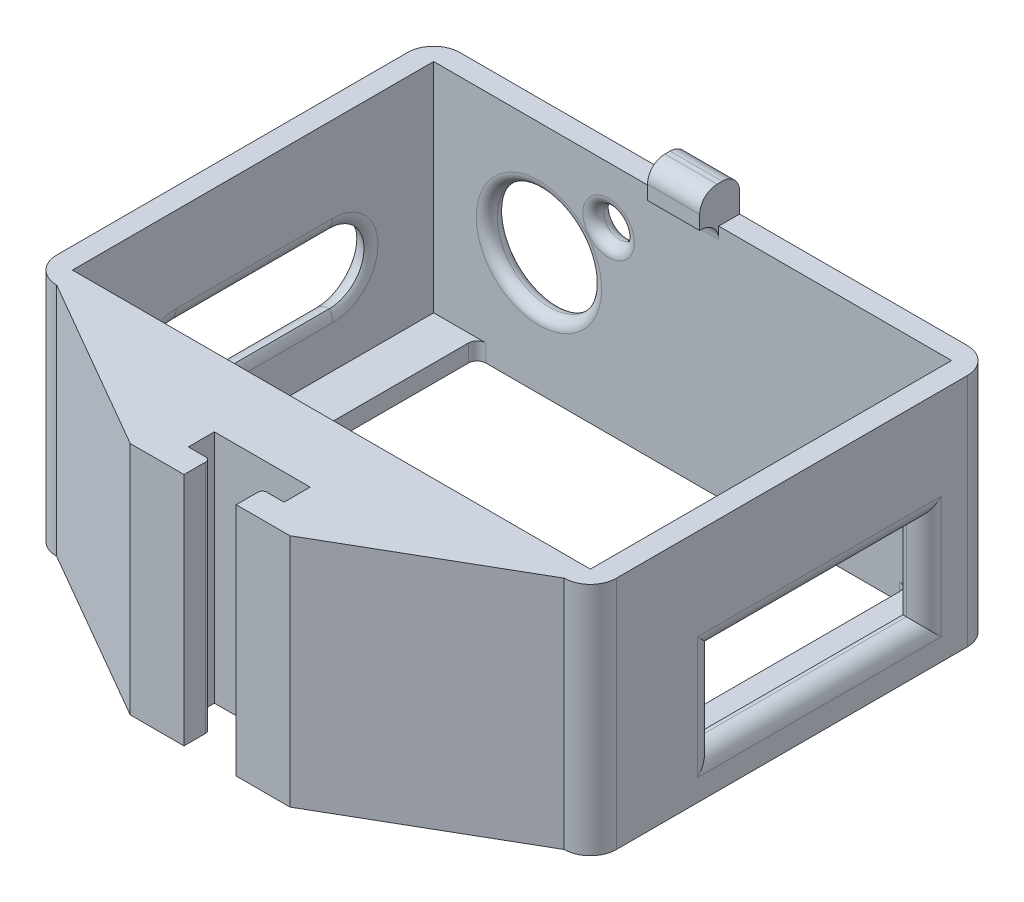
from build123d import *

# Parameters (mm, degrees)
SKETCH_1_W          = 64.3
SKETCH_1_H          = 46.3
SKETCH_1_W_2        = 59.5
SKETCH_1_H_2        = 41.5
EXTRUDE_2_DEPTH     = 27
SKETCH_1_3_W        = 5
SKETCH_1_3_H        = 41.5
EXTRUDE_3_DEPTH     = 2
FILLET_1_R          = 3
FILLET_2_R          = 1
SKETCH_2_R          = 6
SKETCH_2_R_2        = 1.75
CUT_EXTRUDE_2_DEPTH = 8
SKETCH_4_W          = 24
SKETCH_4_H          = 10
CUT_EXTRUDE_4_DEPTH = 12
FILLET_5_R          = 2
CUT_EXTRUDE_5_DEPTH = 12
FILLET_6_R          = 2
FILLET_7_R          = 2
FILLET_16_R         = 1.2
EXTRUDE_9_DEPTH     = 3
EXTRUDE_11_DEPTH    = 27
CUT_EXTRUDE_6_DEPTH = 81.54700491
FILLET_17_R         = 0.5


# Some blends are built 0.0001 mm under size
with BuildPart() as part:
    # Эскиз1 → Бобышка-Вытянуть2 (new body)
    with BuildSketch(Plane(origin=(0, 0, 0), x_dir=(1, 0, 0), z_dir=(0, 1, 0))):
        with Locations((29.75, 20.75)):
            Rectangle(SKETCH_1_W, SKETCH_1_H)
        with Locations((29.75, 20.75)):
            Rectangle(SKETCH_1_W_2, SKETCH_1_H_2, mode=Mode.SUBTRACT)
    extrude(amount=EXTRUDE_2_DEPTH)

    # Эскиз1<3> → Бобышка-Вытянуть3 (add)
    with BuildSketch(Plane(origin=(0, 0, 0), x_dir=(1, 0, 0), z_dir=(0, 1, 0))):
        with Locations((2.5, 20.75)):
            Rectangle(SKETCH_1_3_W, SKETCH_1_3_H)
        with Locations((57, 20.75)):
            Rectangle(SKETCH_1_3_W, SKETCH_1_3_H)
    extrude(amount=EXTRUDE_3_DEPTH)

    # Скругление1
    fillet_1_edges = [part.edges().sort_by_distance(p)[0] for p in [
        (-2.4, 13.5, -43.9),
        (61.9, 13.5, -43.9),
        (61.9, 13.5, 2.4),
        (-2.4, 13.5, 2.4),
    ]]
    fillet(fillet_1_edges, radius=FILLET_1_R)

    # Скругление2
    fillet_2_edges = [part.edges().sort_by_distance(p)[0] for p in [
        (5, 1, 0),
        (5, 1, -41.5),
        (54.5, 1, -41.5),
        (54.5, 1, 0),
    ]]
    fillet(fillet_2_edges, radius=FILLET_2_R)

    # Эскиз2 → Вырез-Вытянуть2 (cut)
    with BuildSketch(Plane(origin=(0, 0, -43.9), x_dir=(-1, 0, 0), z_dir=(0, 0, -1))):
        with Locations((-12.1, 14)):
            Circle(SKETCH_2_R)
        with Locations((-20.1, 20.5)):
            Circle(SKETCH_2_R_2)
    extrude(amount=-CUT_EXTRUDE_2_DEPTH, mode=Mode.SUBTRACT)

    # Эскиз4 → Вырез-Вытянуть4 (cut)
    with BuildSketch(Plane(origin=(61.9, 0, 0), x_dir=(0, 0, -1), z_dir=(1, 0, 0))):
        with Locations((23.9, 9.5)):
            Rectangle(SKETCH_4_W, SKETCH_4_H)
    extrude(amount=-CUT_EXTRUDE_4_DEPTH, mode=Mode.SUBTRACT)

    # Скругление5
    fillet_5_edges = [part.edges().sort_by_distance(p)[0] for p in [
        (61.9, 14.5, -23.9),
        (61.9, 9.5, -35.9),
        (61.9, 9.5, -11.9),
        (61.9, 4.5, -23.9),
    ]]
    fillet(fillet_5_edges, radius=FILLET_5_R)

    # Эскиз10 → Вырез-Вытянуть5 (cut)
    with BuildSketch(Plane.ZY.offset(2.4)):
        with BuildLine():
            Line((-29.9, 16), (-11.9, 16))
            ThreePointArc((-11.9, 16), (-7.9, 12), (-11.9, 8))
            Line((-11.9, 8), (-29.9, 8))
            ThreePointArc((-29.9, 8), (-33.9, 12), (-29.9, 16))
        make_face()
    extrude(amount=-CUT_EXTRUDE_5_DEPTH, mode=Mode.SUBTRACT)

    # Скругление6
    fillet_6_edges = [part.edges().sort_by_distance(p)[0] for p in [
        (-2.4, 16, -20.9),
        (-2.4, 12, -33.9),
        (-2.4, 8, -20.9),
        (-2.4, 12, -7.9),
    ]]
    fillet(fillet_6_edges, radius=FILLET_6_R)

    # Скругление7
    # the kernel refuses this fillet: 2 mm, written as the material it takes off along each edge
    with BuildSketch(Plane(origin=(0, 8, -29.9), x_dir=(-1, 0, 0), z_dir=(0, 0, 1)), Plane(origin=(0, 16, -11.9), x_dir=(-1, 0, 0), z_dir=(0, 0, -1))) as fillet_7_piece_1:
        with BuildLine():
            CenterArc((2, 1.2), FILLET_7_R, 180, 36.869897646)
            Line((0, 1.2), (-0.04, 1.2))
            Line((-0.04, 1.2), (-0.04, 0))
            Line((-0.04, 0), (0, -0.04))
            ThreePointArc((0, -0.04), (0.2, -0.04), (0.368, -0.024))
            Line((0.368, -0.024), (0.4, 0))
        make_face()
    extrude(amount=18, mode=Mode.SUBTRACT)
    with BuildSketch(Plane(origin=(0, 12, -29.9), x_dir=(0, 1, 0), z_dir=(0, 0, 1))) as fillet_7_piece_2:
        with BuildLine():
            CenterArc((5.2, 2), FILLET_7_R, 233.130102354, 36.869897646)
            Line((5.2, 0), (5.2, -0.04))
            Line((5.2, -0.04), (4, -0.04))
            Line((4, -0.04), (3.96, 0))
            ThreePointArc((3.96, 0), (3.96, 0.2), (3.976, 0.368))
            Line((3.976, 0.368), (4, 0.4))
        make_face()
    revolve(axis=Axis((0, 12, -29.9), (-1, 0, 0)), revolution_arc=180, mode=Mode.SUBTRACT)
    with BuildSketch(Plane(origin=(0, 12, -11.9), x_dir=(0, -1, 0), z_dir=(0, 0, -1))) as fillet_7_piece_3:
        with BuildLine():
            CenterArc((5.2, 2), FILLET_7_R, 233.130102354, 36.869897646)
            Line((5.2, 0), (5.2, -0.04))
            Line((5.2, -0.04), (4, -0.04))
            Line((4, -0.04), (3.96, 0))
            ThreePointArc((3.96, 0), (3.96, 0.2), (3.976, 0.368))
            Line((3.976, 0.368), (4, 0.4))
        make_face()
    revolve(axis=Axis((0, 12, -11.9), (-1, 0, 0)), revolution_arc=180, mode=Mode.SUBTRACT)

    # Скругление16
    fillet_16_edges = [part.edges().sort_by_distance(p)[0] for p in [
        (18.1, 14, -41.5),
        (18.1, 14, -43.9),
        (21.85, 20.5, -41.5),
        (21.85, 20.5, -43.9),
    ]]
    fillet(fillet_16_edges, radius=FILLET_16_R - 0.0001)  # a hair under: the kernel refuses the full size

    # Эскиз16 → Бобышка-Вытянуть9 (add, symmetric)
    with BuildSketch(Plane(origin=(29.75, 0, 0), x_dir=(0, 0, -1), z_dir=(1, 0, 0))):
        with BuildLine():
            Line((43.9, 29.261820769), (43.9, 24.626856239))
            Line((43.9, 24.626856239), (41.5, 24.626856239))
            Line((41.5, 24.626856239), (41.5, 25.649781137))
            ThreePointArc((41.5, 25.649781137), (40.914213562, 27.063994699), (39.5, 27.649781137))
            Line((39.5, 27.649781137), (39.315307367, 27.649781137))
            Line((39.315307367, 27.649781137), (39.315307367, 29.261820769))
            ThreePointArc((39.315307367, 29.261820769), (39.901093805, 30.676034332), (41.315307367, 31.261820769))
            Line((41.315307367, 31.261820769), (41.9, 31.261820769))
            ThreePointArc((41.9, 31.261820769), (43.314213562, 30.676034332), (43.9, 29.261820769))
        make_face()
    extrude(amount=EXTRUDE_9_DEPTH, both=True)

    # Эскиз17 → Бобышка-Вытянуть11 (add)
    with BuildSketch(Plane(origin=(0, 27, 0), x_dir=(1, 0, 0), z_dir=(0, 1, 0))):
        Polygon((54.9, -2.4), (29.75, -2.4), (29.75, -11.933833698), (38.386915645, -11.933833698), align=None)
        Polygon((29.75, -2.4), (4.6, -2.4), (21.113084355, -11.933833698), (29.75, -11.933833698), align=None)
        Polygon((29.75, -11.933833698), (29.75, -13.933833698), (38.92281403, -13.933833698), (58.9, -2.4), (54.9, -2.4), (38.386915645, -11.933833698), align=None)
        Polygon((4.6, -2.4), (0.6, -2.4), (20.57718597, -13.933833698), (29.75, -13.933833698), (29.75, -11.933833698), (21.113084355, -11.933833698), align=None)
    extrude(amount=-EXTRUDE_11_DEPTH)

    # Эскиз19 → Вырез-Вытянуть6 (cut, through all)
    with BuildSketch(Plane(origin=(0, 27, 0), x_dir=(1, 0, 0), z_dir=(0, 1, 0))):
        Polygon((26.75, -10.933833698), (26.75, -13.933833698), (29.75, -13.933833698), (29.75, -7.933833698), (24.25, -7.933833698), (24.25, -10.933833698), align=None)
        Polygon((29.75, -7.933833698), (29.75, -13.933833698), (32.75, -13.933833698), (32.75, -10.933833698), (35.25, -10.933833698), (35.25, -7.933833698), align=None)
    extrude(amount=-CUT_EXTRUDE_6_DEPTH, mode=Mode.SUBTRACT)

    # Скругление17
    fillet_17_edges = [part.edges().sort_by_distance(p)[0] for p in [
        (26.75, 13.5, 10.933833698),
        (32.75, 13.5, 10.933833698),
    ]]
    fillet(fillet_17_edges, radius=FILLET_17_R)


solid = part.part
